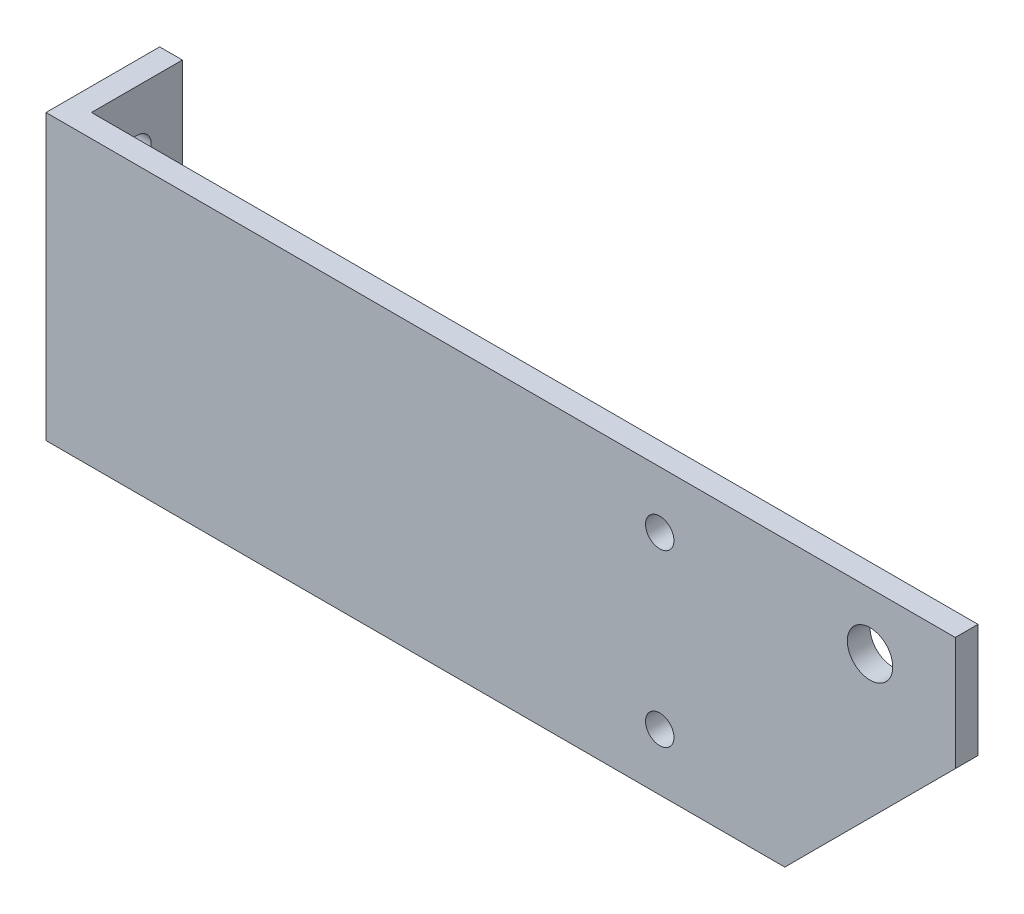
from build123d import *

# Parameters (mm, degrees)
EXTRUDE_1_DEPTH     = 50
SKETCH_2_R          = 2.5
CUT_EXTRUDE_1_DEPTH = 10
SKETCH_3_R          = 2.5
SKETCH_3_R_2        = 4
CUT_EXTRUDE_2_DEPTH = 10
CUT_EXTRUDE_3_DEPTH = 10


with BuildPart() as part:
    # Эскиз1 → Бобышка-Вытянуть1 (new body)
    with BuildSketch(Plane(origin=(0, 0, 0), x_dir=(1, 0, 0), z_dir=(0, 1, 0))):
        Polygon((0, 0), (160, 0), (160, 4), (4, 4), (4, 20), (0, 20), (0, 4), align=None)
    extrude(amount=EXTRUDE_1_DEPTH)

    # Эскиз2 → Вырез-Вытянуть1 (cut)
    with BuildSketch(Plane.ZY):
        with Locations((-12, 40)):
            Circle(SKETCH_2_R)
        with Locations((-12, 10)):
            Circle(SKETCH_2_R)
    extrude(amount=-CUT_EXTRUDE_1_DEPTH, mode=Mode.SUBTRACT)

    # Эскиз3 → Вырез-Вытянуть2 (cut)
    with BuildSketch(Plane.XY):
        with Locations((108, 40)):
            Circle(SKETCH_3_R)
        with Locations((108, 10)):
            Circle(SKETCH_3_R)
        with Locations((145, 40)):
            Circle(SKETCH_3_R_2)
    extrude(amount=-CUT_EXTRUDE_2_DEPTH, mode=Mode.SUBTRACT)

    # Эскиз4 → Вырез-Вытянуть3 (cut)
    with BuildSketch(Plane.XY):
        Polygon((160, 30), (130, 0), (160, 0), align=None)
    extrude(amount=-CUT_EXTRUDE_3_DEPTH, mode=Mode.SUBTRACT)


solid = part.part
